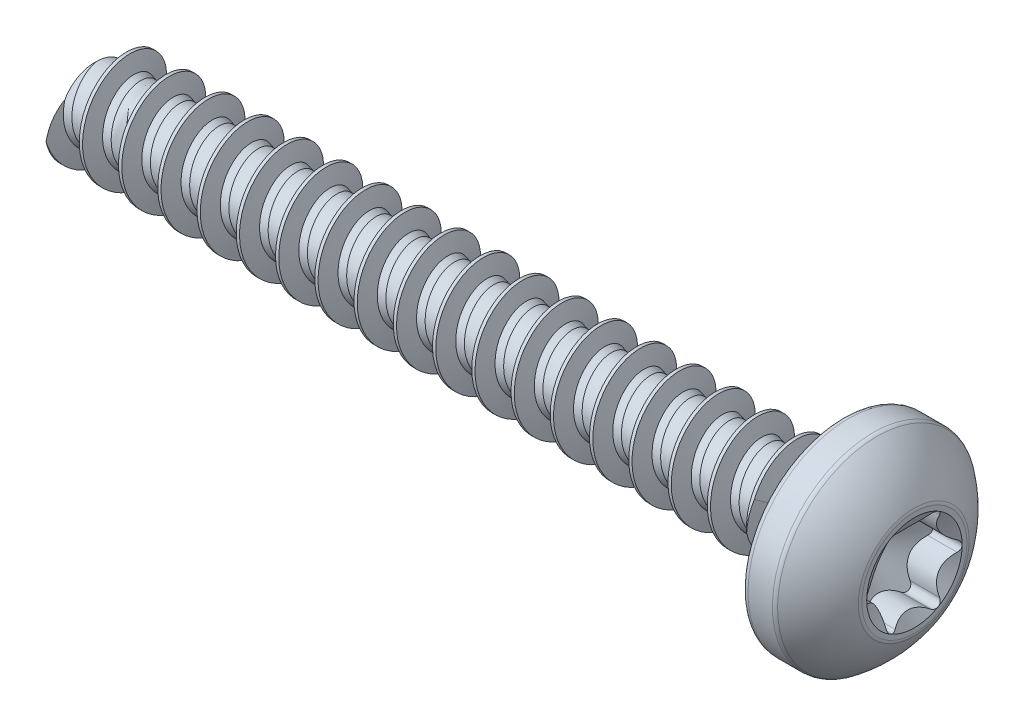
from build123d import *

# Parameters (mm, degrees)
BOSS_EXTRUDE1_REACH = 30.283
SKETCH3_R           = 1.7881600000000017
CUT_SWEEP1_PITCH    = 1.3368421052631352


# Read off the part's stored shape, not the designer's step: Split1
with BuildPart() as part:
    # Sketch2 → Revolve1 (revolve)
    with BuildSketch(Plane.XY):
        with BuildLine():
            Line((-13.9319, 0), (13.9319, 0))
            Line((13.9319, 0), (13.931899999999999, 1.788160000000003))
            ThreePointArc((13.931899999999999, 1.788160000000003), (13.925975521830416, 1.8390747506620386), (13.908518666423348, 1.8872688319984003))
            ThreePointArc((13.908518666423348, 1.8872688319984003), (13.369718331536582, 2.709586053410587), (12.655365567686456, 3.385020389438032))
            ThreePointArc((12.655365567686456, 3.385020389438032), (12.592642326993284, 3.4177180939878724), (12.522813512005373, 3.429))
            Line((12.522813512005373, 3.429), (11.689842, 3.4290000000000003))
            ThreePointArc((11.689842, 3.4290000000000003), (11.53304672812613, 3.3640532718738694), (11.468099999999998, 3.207258))
            Line((11.468099999999998, 3.207258), (11.468100000000002, 1.6468647017543903))
            ThreePointArc((11.468100000000002, 1.6468647017543903), (11.338206543747736, 1.3332741580066554), (11.024616000000002, 1.2033807017543903))
            Line((11.024616000000002, 1.2033807017543903), (10.339139672175989, 1.2033807017543903))
            Line((10.339139672175989, 1.2033807017543903), (10.131257894736843, 1.147678947368426))
            Line((10.131257894736843, 1.147678947368426), (-13.9319, 1.147678947368426))
            Line((-13.9319, 1.147678947368426), (-13.9319, 0))
        make_face()
    revolve(axis=Axis((-13.9319, 0, 0), (-1, -1.3e-16, 0)))

    # Sketch12 → Cut-Revolve3 (revolve, cut)
    with BuildSketch(Plane.XY, mode=Mode.PRIVATE) as cut_revolve3_sk:
        Polygon((13.931899999999999, 1.6256000000000002), (12.930981249999999, 1.6255999999999997), (11.992440652405332, 0), (13.9319, 0), align=None)
    revolve(cut_revolve3_sk.sketch.rotate(Axis((-13.9319, 0, 0), (1, 0, 0)), 90), axis=Axis((-13.9319, 0, 0), (1, 0, 0)), mode=Mode.SUBTRACT)

    # Boss-Extrude1: up to this cone (the profile starts inside it)
    boss_extrude1_end = Plane(origin=(13.9319, 0, 0), z_dir=(1, 0, 0)).offset(-1.9394583475946703) * Cone(1.73205080722e-06, 62.49534018142432, 36.08170047684299, align=(Align.CENTER, Align.CENTER, Align.MIN), mode=Mode.PRIVATE)
    # Sketch3 → Boss-Extrude1 (add, up to the surface)
    with BuildSketch(Plane(origin=(13.9319, 1.82e-15, 0), x_dir=(0, 0, -1), z_dir=(1, 9e-17, 0)), mode=Mode.PRIVATE) as boss_extrude1_sk1:
        Circle(SKETCH3_R)
        with BuildLine():
            ThreePointArc((-0.5982670728652858, 1.4007617197477769), (-2.020231572e-08, 1.2191999999999998), (0.5982670392755188, 1.4007616972920027))
            ThreePointArc((0.5982670392755188, 1.4007616972920027), (0.704526784756697, 1.4349249284986814), (0.8127999999999992, 1.407810896391982))
            ThreePointArc((0.8127999999999992, 1.407810896391982), (0.8904180387039392, 1.327600575313221), (0.9139616975177107, 1.2184953432229815))
            ThreePointArc((0.9139616975177107, 1.2184953432229815), (1.0558581621928305, 0.6096000174957187), (1.512228734140842, 0.18226639438649944))
            ThreePointArc((1.512228734140842, 0.18226639438649944), (1.5949448329817764, 0.1073243710034698), (1.6255999999999988, -2e-16))
            ThreePointArc((1.6255999999999988, -2e-16), (1.5949448436520552, -0.10732435384891657), (1.5122287703829966, -0.18226637652479583))
            ThreePointArc((1.5122287703829966, -0.18226637652479583), (1.0558581823951458, -0.609599982504282), (0.9139616948653237, -1.2184953029055041))
            ThreePointArc((0.9139616948653237, -1.2184953029055041), (0.8904180482250796, -1.3276005574952126), (0.8128000000000002, -1.4078108963919829))
            ThreePointArc((0.8128000000000002, -1.4078108963919829), (0.7045268049481163, -1.4349249291621384), (0.5982670728652858, -1.4007617197477782))
            ThreePointArc((0.5982670728652858, -1.4007617197477782), (2.020231577e-08, -1.2192000000000012), (-0.5982670392755187, -1.400761697292004))
            ThreePointArc((-0.5982670392755187, -1.400761697292004), (-0.704526784756697, -1.434924928498683), (-0.8127999999999992, -1.4078108963919835))
            ThreePointArc((-0.8127999999999992, -1.4078108963919835), (-0.8904180387039388, -1.3276005753132223), (-0.9139616975177103, -1.2184953432229833))
            ThreePointArc((-0.9139616975177103, -1.2184953432229833), (-1.0558581621928298, -0.6096000174957201), (-1.5122287341408422, -0.1822663943865014))
            ThreePointArc((-1.5122287341408422, -0.1822663943865014), (-1.5949448329817764, -0.10732437100347156), (-1.6255999999999988, -1.79e-15))
            ThreePointArc((-1.6255999999999988, -1.79e-15), (-1.5949448436520552, 0.10732435384891427), (-1.512228770382997, 0.1822663765247936))
            ThreePointArc((-1.512228770382997, 0.1822663765247936), (-1.0558581823951454, 0.6095999825042803), (-0.9139616948653242, 1.218495302905503))
            ThreePointArc((-0.9139616948653242, 1.218495302905503), (-0.8904180482250796, 1.3276005574952117), (-0.8127999999999995, 1.407810896391982))
            ThreePointArc((-0.8127999999999995, 1.407810896391982), (-0.7045268049481159, 1.434924929162137), (-0.5982670728652858, 1.4007617197477769))
        make_face(mode=Mode.SUBTRACT)
    boss_extrude1_tool1 = extrude(boss_extrude1_sk1.sketch, amount=-BOSS_EXTRUDE1_REACH, mode=Mode.PRIVATE) & boss_extrude1_end
    add(boss_extrude1_tool1.solids().sort_by_distance((13.9319, 0, 1.737583))[0])

    # Cut-Extrude2 cone 1 section (through the dimple's axis) → Cut-Extrude2 (revolve, cut)
    with BuildSketch(Plane(origin=(13.9319, 0, 0), x_dir=(0, 0, -1), z_dir=(0, 1, 0))):
        Polygon((0, 0), (1.6256, 0), (0, 0.938540598), align=None)
    revolve(axis=Axis((13.9319, 0, 0), (-1, 0, 0)), mode=Mode.SUBTRACT)

    # Split1 outline → Split1 (revolve, cut)
    with BuildSketch(Plane.YX):
        Polygon((1.147678947, -13.9319), (1.147678947, 10.131257895), (0, 5.848061752), (0, -13.9319), align=None)
    revolve(axis=Axis((0, 0, 0), (1, 0, 0)), mode=Mode.SUBTRACT)


with BuildPart() as body_2:
    # Split1 2 outline → Split1 2 (revolve)
    with BuildSketch(Plane.YX):
        Polygon((1.147678947, -13.9319), (1.147678947, 10.131257895), (0, 5.848061752), (0, -13.9319), align=None)
    revolve(axis=Axis((0, 0, 0), (1, 0, 0)))

    # Sketch9 → Revolve2 (revolve)
    with BuildSketch(Plane.XY):
        Polygon((-13.9319, 1.7526), (-13.9319, 0), (10.131257894736843, 0), (10.131257894736843, 1.752600000000003), align=None)
    revolve(axis=Axis((-13.9319, 0, 0), (1, 0, 0)))

    # Cut-Sweep1: the profile of Sketch7 screwed along a right-hand helix of 20 turns, 8 arcs to a turn; built about Z, then put on its axis
    cut_sweep1_z = Axis((0, 0, 0), (0, 0, 1))
    cut_sweep1_corners = [(1.7526, 0, -0.488505719), (1.209748172, 0, -0.633962427), (1.147678947, 0, -0.865607928), (1.147678947, 0, -1.336842105), (1.209748172, 0, -1.568487606), (1.7526, 0, -1.713944315), (1.897317403, 0, -1.713944315), (1.897317403, 0, -0.488505719)]
    with BuildLine(mode=Mode.PRIVATE) as cut_sweep1_profile:
        Line(cut_sweep1_corners[0], cut_sweep1_corners[1])
        Line(cut_sweep1_corners[1], cut_sweep1_corners[2])
        Line(cut_sweep1_corners[2], cut_sweep1_corners[3])
        Line(cut_sweep1_corners[3], cut_sweep1_corners[4])
        Line(cut_sweep1_corners[4], cut_sweep1_corners[5])
        Line(cut_sweep1_corners[5], cut_sweep1_corners[6])
        Line(cut_sweep1_corners[6], cut_sweep1_corners[7])
        Line(cut_sweep1_corners[7], cut_sweep1_corners[0])
    cut_sweep1_cap = Face(cut_sweep1_profile.wire())
    cut_sweep1_turn_angles = [0, 22.5, 45, 67.5, 90, 112.5, 135, 157.5, 180, 202.5, 225, 247.5, 270, 292.5, 315, 337.5, 360]
    cut_sweep1_turn_weights = [1, 0.9238795325112867, 1, 0.9238795325112867, 1, 0.9238795325112867, 1, 0.9238795325112867, 1, 0.9238795325112867, 1, 0.9238795325112867, 1, 0.9238795325112867, 1, 0.9238795325112867, 1]
    cut_sweep1_turn_rails = [Edge.make_bspline([Vector(p[0], p[1], 0).rotate(cut_sweep1_z, cut_sweep1_turn_angles[k]) / cut_sweep1_turn_weights[k] + Vector(0, 0, p[2] + CUT_SWEEP1_PITCH * cut_sweep1_turn_angles[k] / 360) for k in range(17)], [0, 0, 0, 1, 1, 2, 2, 3, 3, 4, 4, 5, 5, 6, 6, 7, 7, 8, 8, 8], 2, cut_sweep1_turn_weights) for p in cut_sweep1_corners]
    cut_sweep1_turn_sides = [Face.make_surface_from_curves(cut_sweep1_turn_rails[p[0]], cut_sweep1_turn_rails[p[1]]) for p in [(0, 1), (1, 2), (2, 3), (3, 4), (4, 5), (5, 6), (6, 7), (7, 0)]]
    cut_sweep1 = Plane(origin=(-13.9319, -1.79e-15, 0), x_dir=(-9e-17, 1, -6.98e-15), z_dir=(1, 9e-17, 0)) * Solid(Shell([*[p.moved(Location((0, 0, CUT_SWEEP1_PITCH * i))) for i in range(20) for p in cut_sweep1_turn_sides], cut_sweep1_cap, cut_sweep1_cap.rotate(cut_sweep1_z, 7200).moved(Location((0, 0, CUT_SWEEP1_PITCH * 7200 / 360)))]))
    add(cut_sweep1, mode=Mode.SUBTRACT)

    # Sketch11 → Cut-Revolve2 (revolve, cut)
    with BuildSketch(Plane.XY):
        Polygon((10.131257894736843, 1.147678947368426), (9.969169787199627, 1.752600000000003), (10.131257894736843, 1.752600000000003), align=None)
    revolve(axis=Axis((-13.9319, 0, 0), (1, 0, 0)), mode=Mode.SUBTRACT)

    # Combine1: union part
    add(part.part)


solid = body_2.part
